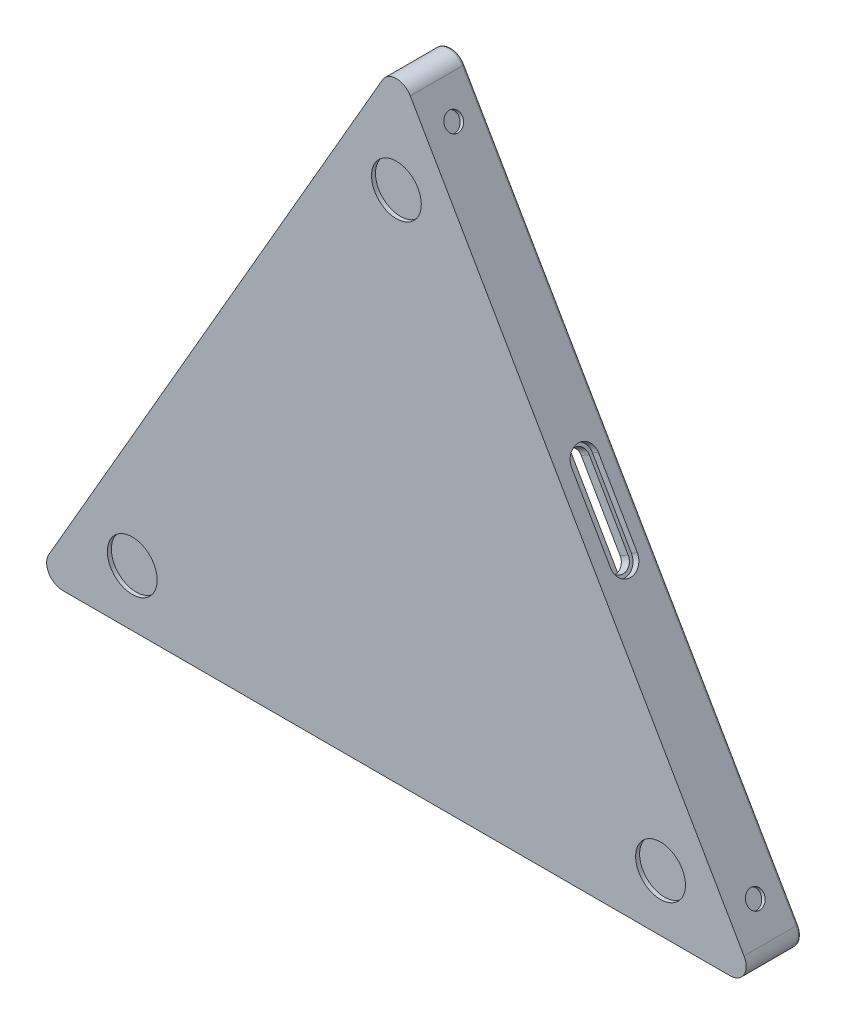
from build123d import *

# Parameters (mm, degrees)
BOSS_EXTRU_1_DEPTH      = 15
BOSS_EXTRU_2_DEPTH      = 2
ESQUISSE3_W             = 164.930853143
ESQUISSE3_H             = 1.4
BOSS_EXTRU_3_DEPTH      = 11
ENL_V_MAT_EXTRU_1_DEPTH = 2.1
ENL_V_MAT_EXTRU_2_REACH = 232.446
CONG_1_R                = 5
ESQUISSE6_R             = 7.75
ENL_V_MAT_EXTRU_3_DEPTH = 1.24
ESQUISSE7_R             = 2.75
ENL_V_MAT_EXTRU_4_DEPTH = 1.24
CONG_2_R                = 5
ENL_V_MAT_EXTRU_6_DEPTH = 2
ESQUISSE8_R             = 2.75
ENL_V_MAT_EXTRU_5_DEPTH = 4.1
CONG_3_R                = 0.75


with BuildPart() as part:
    # Esquisse1 → Boss.-Extru.1 (new body)
    with BuildSketch(Plane.XY):
        Polygon((-169.71822613, -51.377911564), (-57.21822613, 143.477804287), (55.28177387, -51.377911564), align=None)
        Polygon((46.621519833, -46.377911564), (-161.057972092, -46.377911564), (-57.21822613, 133.477804287), align=None, mode=Mode.SUBTRACT)
    extrude(amount=BOSS_EXTRU_1_DEPTH)

    # Esquisse2 → Boss.-Extru.2 (add)
    with BuildSketch(Plane.XY.offset(15)):
        Polygon((-57.21822613, 143.477804287), (-169.71822613, -51.377911564), (55.28177387, -51.377911564), align=None)
    extrude(amount=BOSS_EXTRU_2_DEPTH)

    # Esquisse3 → Boss.-Extru.3 (add)
    with BuildSketch(Plane(origin=(0, 0, 15), x_dir=(-1, 0, 0), z_dir=(0, 0, -1))):
        Polygon((53.949011072, 117.815357706), (-28.5164155, -25.018950984), (-27.303979934, -25.718950984), (55.161446637, 117.115357706), align=None)
        Polygon((149.019751584, -35.527102012), (147.807316018, -36.227102012), (65.341889447, 106.607206677), (66.554325012, 107.307206677), align=None)
        with Locations((51.042590893, -40.677911564)):
            Rectangle(ESQUISSE3_W, ESQUISSE3_H)
    extrude(amount=BOSS_EXTRU_3_DEPTH)

    # Esquisse4 → Enlèv. mat.-Extru.1 (cut)
    with BuildSketch(Plane(origin=(19.214042099, 11.093232378, 0), x_dir=(0, 0, -1), z_dir=(0.8660254037844387, 0.5000000000000001, 0))):
        with BuildLine():
            Line((-12.65, 52.464536457), (-12.65, 28.264536457))
            ThreePointArc((-12.65, 28.264536457), (-8.5, 24.114536457), (-4.35, 28.264536457))
            Line((-4.35, 28.264536457), (-4.35, 52.464536457))
            ThreePointArc((-4.35, 52.464536457), (-8.5, 56.614536457), (-12.65, 52.464536457))
        make_face()
    enl_v_mat_extru_1 = extrude(amount=-ENL_V_MAT_EXTRU_1_DEPTH, mode=Mode.SUBTRACT)

    # Esquisse5 → Enlèv. mat.-Extru.2 (cut, up to next)
    with BuildSketch(Plane(origin=(17.395388751, 10.043232378, 0), x_dir=(0, 0, -1), z_dir=(0.8660254037844386, 0.5000000000000003, 0)), mode=Mode.PRIVATE) as enl_v_mat_extru_2_sk1:
        with BuildLine():
            Line((-11.65, 52.464536457), (-11.65, 28.264536457))
            ThreePointArc((-11.65, 28.264536457), (-8.5, 25.114536457), (-5.35, 28.264536457))
            Line((-5.35, 28.264536457), (-5.35, 52.464536457))
            ThreePointArc((-5.35, 52.464536457), (-8.5, 55.614536457), (-11.65, 52.464536457))
        make_face()
    enl_v_mat_extru_2_tool1 = extrude(enl_v_mat_extru_2_sk1.sketch, amount=-ENL_V_MAT_EXTRU_2_REACH, mode=Mode.PRIVATE) & part.part
    enl_v_mat_extru_2 = enl_v_mat_extru_2_tool1.solids().sort_by_distance((-2.786879, 44.999946, 8.5))[0]
    add(enl_v_mat_extru_2, mode=Mode.SUBTRACT)

    # Congé1
    cong_1_edges = [part.edges().sort_by_distance(p)[0] for p in [
        (46.621519833, -46.377911564, 7.5),
        (-57.21822613, 133.477804287, 7.5),
        (-161.057972092, -46.377911564, 7.5),
        (-169.71822613, -51.377911564, 8.5),
        (-57.21822613, 143.477804287, 8.5),
        (55.28177387, -51.377911564, 8.5),
    ]]
    fillet(cong_1_edges, radius=CONG_1_R)

    # Symétrie1: Enlèv. mat.-Extru.1, Enlèv. mat.-Extru.2 across plane
    add(enl_v_mat_extru_1.mirror(Plane(origin=(-8.426844836, -14.595723404, 0), x_dir=(0, 0, 1), z_dir=(0.5000000000000001, 0.8660254037844386, 0))), mode=Mode.SUBTRACT)
    add(enl_v_mat_extru_2.mirror(Plane(origin=(-8.426844836, -14.595723404, 0), x_dir=(0, 0, 1), z_dir=(0.5000000000000001, 0.8660254037844386, 0))), mode=Mode.SUBTRACT)

    # Esquisse6 → Enlèv. mat.-Extru.3 (cut)
    with BuildSketch(Plane.XY.offset(17)):
        with Locations((-57.21822613, 108.477804287)):
            Circle(ESQUISSE6_R)
        with Locations(Location((-139.407336997, -33.877911564, 0), (0, 0, 180))):
            Circle(ESQUISSE6_R)
        with Locations((24.970884738, -33.877911564)):
            Circle(ESQUISSE6_R)
    extrude(amount=-ENL_V_MAT_EXTRU_3_DEPTH, mode=Mode.SUBTRACT)

    # Esquisse7 → Enlèv. mat.-Extru.4 (cut)
    with BuildSketch(Plane.XZ.offset(51.377911564)):
        with Locations((36.621519833, 8.5)):
            Circle(ESQUISSE7_R)
        with Locations(Location((-151.057972092, 8.5, 0), (0, 0, 180))):
            Circle(ESQUISSE7_R)
    enl_v_mat_extru_4 = extrude(amount=-ENL_V_MAT_EXTRU_4_DEPTH, mode=Mode.SUBTRACT)

    # Symétrie2: Enlèv. mat.-Extru.4 across plane
    add(enl_v_mat_extru_4.mirror(Plane(origin=(-8.426844836, -14.595723404, 0), x_dir=(0, 0, 1), z_dir=(0.5000000000000001, 0.8660254037844386, 0))), mode=Mode.SUBTRACT)

    # Symétrie3: Enlèv. mat.-Extru.4 across plane
    add(enl_v_mat_extru_4.mirror(Plane(origin=(-20.182268228, 34.956713983, 0), x_dir=(0, 0, 1), z_dir=(0.5000000000000001, -0.8660254037844387, 0))), mode=Mode.SUBTRACT)

    # Congé2
    cong_2_edges = [part.edges().sort_by_distance(p)[0] for p in [
        (-12.716297786, 46.398203361, 15),
        (-107.787038298, 35.890052333, 15),
        (-51.042590892, -41.377911564, 15),
    ]]
    fillet(cong_2_edges, radius=CONG_2_R - 0.0001)  # a hair under: the kernel refuses the full size

    # Esquisse9 → Enlèv. mat.-Extru.6 (cut)
    with BuildSketch(Plane(origin=(0, 0, 0), x_dir=(-1, 0, 0), z_dir=(0, 0, -1))):
        with BuildLine():
            Line((164.089061005, -44.627911564), (60.249315043, 135.227804287))
            ThreePointArc((60.249315043, 135.227804287), (57.21822613, 136.977804287), (54.187137216, 135.227804287))
            Line((54.187137216, 135.227804287), (-49.652608746, -44.627911564))
            ThreePointArc((-49.652608746, -44.627911564), (-49.652608746, -48.127911564), (-46.621519833, -49.877911564))
            Line((-46.621519833, -49.877911564), (161.057972092, -49.877911564))
            ThreePointArc((161.057972092, -49.877911564), (164.089061005, -48.127911564), (164.089061005, -44.627911564))
        make_face()
    extrude(amount=-ENL_V_MAT_EXTRU_6_DEPTH, mode=Mode.SUBTRACT)

    # Esquisse8 → Enlèv. mat.-Extru.5 (cut)
    with BuildSketch(Plane(origin=(0, 0, 0), x_dir=(-1, 0, 0), z_dir=(0, 0, -1))):
        with Locations((-45.914902423, -45.969945813)):
            Circle(ESQUISSE8_R)
        with Locations((57.21822613, 132.661872783)):
            Circle(ESQUISSE8_R)
        with Locations((160.351354682, -45.969945813)):
            Circle(ESQUISSE8_R)
    extrude(amount=-ENL_V_MAT_EXTRU_5_DEPTH, mode=Mode.SUBTRACT)

    # Congé3
    cong_3_edges = [part.edges().sort_by_distance(p)[0] for p in [
        (-113.46822613, 46.049946361, 0),
        (-57.21822613, -51.377911564, 0),
        (-0.96822613, 46.049946361, 0),
        (50.951646852, -48.877911564, 0),
        (-165.388099111, -48.877911564, 0),
        (-57.21822613, 138.477804287, 0),
        (-112.169188024, 45.299946361, 0),
        (-2.267264235, 45.299946361, 0),
        (-57.21822613, -49.877911564, 0),
    ]]
    fillet(cong_3_edges, radius=CONG_3_R - 0.0001)  # a hair under: the kernel refuses the full size


solid = part.part
